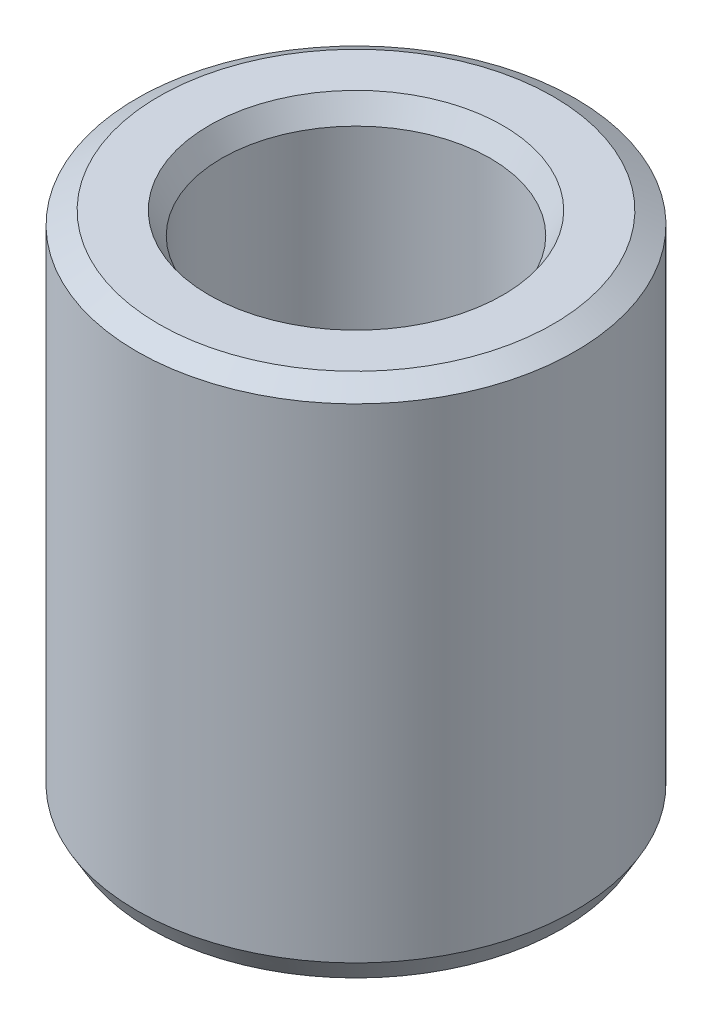
from build123d import *
from OCP.BRepFilletAPI import BRepFilletAPI_MakeChamfer

# Parameters (mm, degrees)
SKETCH1_R           = 47.5
BOSS_EXTRUDE1_DEPTH = 112.433210184
SKETCH2_R           = 29.080337965
CUT_EXTRUDE1_DEPTH  = 131.97223657
CHAMFER1_SIZE       = 2.751174923
CHAMFER1_SIZE2      = 4.765174747


with BuildPart() as part:
    # Sketch1 → Boss-Extrude1 (new body)
    with BuildSketch(Plane(origin=(0, 0, 0), x_dir=(1, 0, 0), z_dir=(0, 1, 0))):
        Circle(SKETCH1_R)
    extrude(amount=BOSS_EXTRUDE1_DEPTH)

    # Sketch2 → Cut-Extrude1 (cut, through all)
    with BuildSketch(Plane(origin=(0, 0, 0), x_dir=(1, 0, 0), z_dir=(0, 1, 0))):
        Circle(SKETCH2_R)
    extrude(amount=CUT_EXTRUDE1_DEPTH, mode=Mode.SUBTRACT)

    # Chamfer1: one chamfer whose edges measure the first distance from different faces: ONE call of the kernel's chamfer builder (chamfer() names one face for all edges)
    chamfer1_edges_1 = [part.edges().sort_by_distance(p)[0] for p in [
        (-29.080337965, 112.433210184, 0),
    ]]
    chamfer1_side_1 = [part.faces().sort_by_distance(p)[0] for p in [
        (-46.156497116, 112.433210184, 0),
    ]]
    chamfer1_edges_2 = [part.edges().sort_by_distance(p)[0] for p in [
        (-29.080337965, 0, 0),
    ]]
    chamfer1_side_2 = [part.faces().sort_by_distance(p)[0] for p in [
        (-29.080337965, 56.216605092, 0),
    ]]
    chamfer1_edges_3 = [part.edges().sort_by_distance(p)[0] for p in [
        (-47.5, 0, 0),
    ]]
    chamfer1_side_3 = [part.faces().sort_by_distance(p)[0] for p in [
        (-46.156497116, 0, 0),
    ]]
    chamfer1_edges_4 = [part.edges().sort_by_distance(p)[0] for p in [
        (-47.5, 112.433210184, 0),
    ]]
    chamfer1_side_4 = [part.faces().sort_by_distance(p)[0] for p in [
        (-47.5, 56.216605092, 0),
    ]]
    chamfer1 = BRepFilletAPI_MakeChamfer(part.part.solid().wrapped)
    for e in chamfer1_edges_1:
        chamfer1.Add(CHAMFER1_SIZE, CHAMFER1_SIZE2, e.wrapped, chamfer1_side_1[0].wrapped)  # the first distance lies on this face
    for e in chamfer1_edges_2:
        chamfer1.Add(CHAMFER1_SIZE, CHAMFER1_SIZE2, e.wrapped, chamfer1_side_2[0].wrapped)  # the first distance lies on this face
    for e in chamfer1_edges_3:
        chamfer1.Add(CHAMFER1_SIZE, CHAMFER1_SIZE2, e.wrapped, chamfer1_side_3[0].wrapped)  # the first distance lies on this face
    for e in chamfer1_edges_4:
        chamfer1.Add(CHAMFER1_SIZE, CHAMFER1_SIZE2, e.wrapped, chamfer1_side_4[0].wrapped)  # the first distance lies on this face
    add(Compound.cast(chamfer1.Shape()), mode=Mode.REPLACE)


solid = part.part
